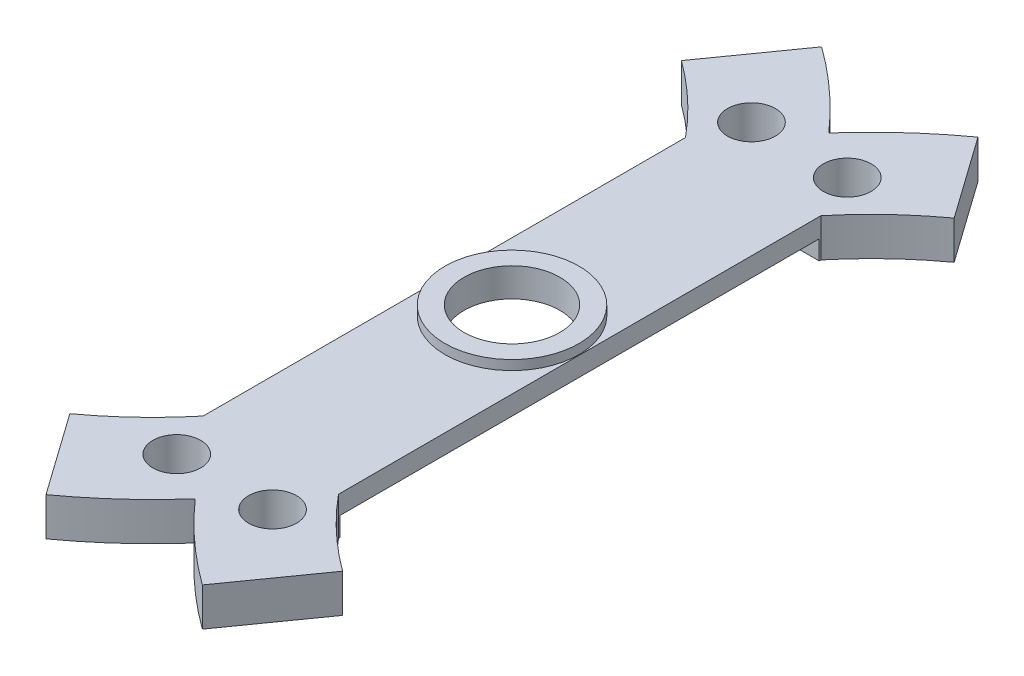
from build123d import *

# Parameters (mm, degrees)
SKETCH1_R               = 2.5
BOSS_EXTRUDE1_DEPTH     = 2
BOSS_EXTRUDE1_2_DEPTH   = 2
BOSS_EXTRUDE3_OUTLINE_R = 2.5
BOSS_EXTRUDE3_DEPTH     = 2
SKETCH6_R               = 5
CUT_EXTRUDE1_DEPTH      = 4
CUT_EXTRUDE2_START      = -10
CUT_EXTRUDE2_DEPTH      = 10
BOSS_EXTRUDE4_START     = 1
SKETCH8_R               = 7
SKETCH8_R_2             = 5
BOSS_EXTRUDE4_DEPTH     = 1


# Read off the part's stored shape, not the designer's step: Boss-Extrude3
with BuildPart() as part:
    # Sketch1 → Boss-Extrude1 (new body)
    with BuildSketch(Plane(origin=(0, 0, 0), x_dir=(1, 0, 0), z_dir=(0, 1, 0))):
        with BuildLine():
            ThreePointArc((23.674984177, 34.026642345), (27.138423224, 37.66837111), (31.041417883, 40.83447773))
            Line((31.041417883, 40.83447773), (24.387097577, 50.213711241))
            ThreePointArc((24.387097577, 50.213711241), (20.045094669, 46.759453741), (16.108243271, 42.849711395))
            ThreePointArc((16.108243271, 42.849711395), (12.171391874, 46.759453741), (7.829388966, 50.213711241))
            Line((7.829388966, 50.213711241), (1.175068659, 40.83447773))
            ThreePointArc((1.175068659, 40.83447773), (5.078063318, 37.66837111), (8.541502365, 34.026642345))
            Line((8.541502365, 34.026642345), (23.674984177, 34.026642345))
        make_face()
        with Locations(Location((11.108243271, 39.026642345, 0), (0, 0, 270))):
            Circle(SKETCH1_R, mode=Mode.SUBTRACT)
        with Locations(Location((21.108243271, 39.026642345, 0), (0, 0, 270))):
            Circle(SKETCH1_R, mode=Mode.SUBTRACT)
    extrude(amount=BOSS_EXTRUDE1_DEPTH)



with BuildPart() as body_2:
    # Sketch1 → Boss-Extrude1 2 (new body)
    with BuildSketch(Plane(origin=(0, 0, 0), x_dir=(1, 0, 0), z_dir=(0, 1, 0))):
        with BuildLine():
            Line((24.387097577, -32.160426552), (31.041417883, -22.781193041))
            ThreePointArc((31.041417883, -22.781193041), (27.138423224, -19.615086421), (23.674984177, -15.973357655))
            Line((23.674984177, -15.973357655), (8.541502365, -15.973357655))
            ThreePointArc((8.541502365, -15.973357655), (5.078063318, -19.615086421), (1.175068659, -22.781193041))
            Line((1.175068659, -22.781193041), (7.829388966, -32.160426552))
            ThreePointArc((7.829388966, -32.160426552), (12.171391874, -28.706169052), (16.108243271, -24.796426706))
            ThreePointArc((16.108243271, -24.796426706), (20.045094669, -28.706169052), (24.387097577, -32.160426552))
        make_face()
        with Locations(Location((11.108243271, -20.973357655, 0), (0, 0, 270))):
            Circle(SKETCH1_R, mode=Mode.SUBTRACT)
        with Locations(Location((21.108243271, -20.973357655, 0), (0, 0, 270))):
            Circle(SKETCH1_R, mode=Mode.SUBTRACT)
    extrude(amount=BOSS_EXTRUDE1_2_DEPTH)


with BuildPart() as part_1:
    add(part.part)

    add(body_2.part)  # Boss-Extrude3 merges body 2
    # Boss-Extrude3 outline → Boss-Extrude3 (add)
    with BuildSketch(Plane(origin=(0, 2, 0), x_dir=(1, 0, 0), z_dir=(0, 1, 0))):
        with BuildLine():
            ThreePointArc((16.108243271, 42.849711395), (12.171391874, 46.759453741), (7.829388966, 50.213711241))
            Line((7.829388966, 50.213711241), (1.175068659, 40.83447773))
            ThreePointArc((1.175068659, 40.83447773), (5.078063318, 37.66837111), (8.541502365, 34.026642345))
            Line((8.541502365, 34.026642345), (8.541502365, -15.973357655))
            ThreePointArc((8.541502365, -15.973357655), (5.078063318, -19.615086421), (1.175068659, -22.781193041))
            Line((1.175068659, -22.781193041), (7.829388966, -32.160426552))
            ThreePointArc((7.829388966, -32.160426552), (12.171391874, -28.706169052), (16.108243271, -24.796426706))
            ThreePointArc((16.108243271, -24.796426706), (20.045094669, -28.706169052), (24.387097577, -32.160426552))
            Line((24.387097577, -32.160426552), (31.041417883, -22.781193041))
            ThreePointArc((31.041417883, -22.781193041), (27.138423224, -19.615086421), (23.674984177, -15.973357655))
            Line((23.674984177, -15.973357655), (23.674984177, 34.026642345))
            ThreePointArc((23.674984177, 34.026642345), (27.138423224, 37.66837111), (31.041417883, 40.83447773))
            Line((31.041417883, 40.83447773), (24.387097577, 50.213711241))
            ThreePointArc((24.387097577, 50.213711241), (20.045094669, 46.759453741), (16.108243271, 42.849711395))
        make_face()
        with Locations((11.108243271, -20.973357655)):
            Circle(BOSS_EXTRUDE3_OUTLINE_R, mode=Mode.SUBTRACT)
        with Locations((21.108243271, -20.973357655)):
            Circle(BOSS_EXTRUDE3_OUTLINE_R, mode=Mode.SUBTRACT)
        with Locations((11.108243271, 39.026642345)):
            Circle(BOSS_EXTRUDE3_OUTLINE_R, mode=Mode.SUBTRACT)
        with Locations((21.108243271, 39.026642345)):
            Circle(BOSS_EXTRUDE3_OUTLINE_R, mode=Mode.SUBTRACT)
    extrude(amount=BOSS_EXTRUDE3_DEPTH)

    # Sketch6 → Cut-Extrude1 (cut)
    with BuildSketch(Plane(origin=(0, 4, 0), x_dir=(1, 0, 0), z_dir=(0, 1, 0))):
        with Locations(Location((16.108243271, 9.024711395, 0), (0, 0, 270))):
            Circle(SKETCH6_R)
    extrude(amount=-CUT_EXTRUDE1_DEPTH, mode=Mode.SUBTRACT)

    # Sketch7 → Cut-Extrude2 (cut)
    with BuildSketch(Plane(origin=(0, 4, 0), x_dir=(1, 0, 0), z_dir=(0, 1, 0)).offset(CUT_EXTRUDE2_START)):
        with BuildLine():
            Line((1.175068659, -22.781193041), (7.829388966, -32.160426552))
            ThreePointArc((7.829388966, -32.160426552), (12.171391874, -28.706169052), (16.108243271, -24.796426706))
            ThreePointArc((16.108243271, -24.796426706), (20.045094669, -28.706169052), (24.387097577, -32.160426552))
            Line((24.387097577, -32.160426552), (31.041417883, -22.781193041))
            ThreePointArc((31.041417883, -22.781193041), (27.138423224, -19.615086421), (23.674984177, -15.973357655))
            Line((23.674984177, -15.973357655), (23.674984177, 34.026642345))
            ThreePointArc((23.674984177, 34.026642345), (27.138423224, 37.66837111), (31.041417883, 40.83447773))
            Line((31.041417883, 40.83447773), (24.387097577, 50.213711241))
            ThreePointArc((24.387097577, 50.213711241), (20.045094669, 46.759453741), (16.108243271, 42.849711395))
            ThreePointArc((16.108243271, 42.849711395), (12.171391874, 46.759453741), (7.829388966, 50.213711241))
            Line((7.829388966, 50.213711241), (1.175068659, 40.83447773))
            ThreePointArc((1.175068659, 40.83447773), (5.078063318, 37.66837111), (8.541502365, 34.026642345))
            Line((8.541502365, 34.026642345), (8.541502365, -15.973357655))
            ThreePointArc((8.541502365, -15.973357655), (5.078063318, -19.615086421), (1.175068659, -22.781193041))
        make_face()
        with BuildLine():
            Line((1.870348493, -22.897086458), (7.946416825, -31.461276502))
            ThreePointArc((7.946416825, -31.461276502), (12.232412061, -27.97896903), (16.108243271, -24.045249044))
            ThreePointArc((16.108243271, -24.045249044), (19.984074481, -27.97896903), (24.270069717, -31.461276502))
            Line((24.270069717, -31.461276502), (30.34613805, -22.897086458))
            ThreePointArc((30.34613805, -22.897086458), (26.549691802, -19.749820127), (23.174984177, -16.154039555))
            Line((23.174984177, -16.154039555), (23.174984177, 34.207324244))
            ThreePointArc((23.174984177, 34.207324244), (26.549691802, 37.803104816), (30.34613805, 40.950371147))
            Line((30.34613805, 40.950371147), (24.270069717, 49.514561191))
            ThreePointArc((24.270069717, 49.514561191), (19.984074481, 46.032253719), (16.108243271, 42.098533733))
            ThreePointArc((16.108243271, 42.098533733), (12.232412061, 46.032253719), (7.946416825, 49.514561191))
            Line((7.946416825, 49.514561191), (1.870348493, 40.950371147))
            ThreePointArc((1.870348493, 40.950371147), (5.666794741, 37.803104816), (9.041502365, 34.207324244))
            Line((9.041502365, 34.207324244), (9.041502365, -16.154039555))
            ThreePointArc((9.041502365, -16.154039555), (5.666794741, -19.749820127), (1.870348493, -22.897086458))
        make_face(mode=Mode.SUBTRACT)
    extrude(amount=CUT_EXTRUDE2_DEPTH, mode=Mode.SUBTRACT)

    # Sketch8 → Boss-Extrude4 (add)
    with BuildSketch(Plane(origin=(0, 4, 0), x_dir=(1, 0, 0), z_dir=(0, 1, 0)).offset(BOSS_EXTRUDE4_START)):
        with Locations(Location((16.108243271, 9.024711395, 0), (0, 0, 270))):
            Circle(SKETCH8_R)
        with Locations(Location((16.108243271, 9.024711395, 0), (0, 0, 270))):
            Circle(SKETCH8_R_2, mode=Mode.SUBTRACT)
    extrude(amount=-BOSS_EXTRUDE4_DEPTH)


solid = part_1.part
